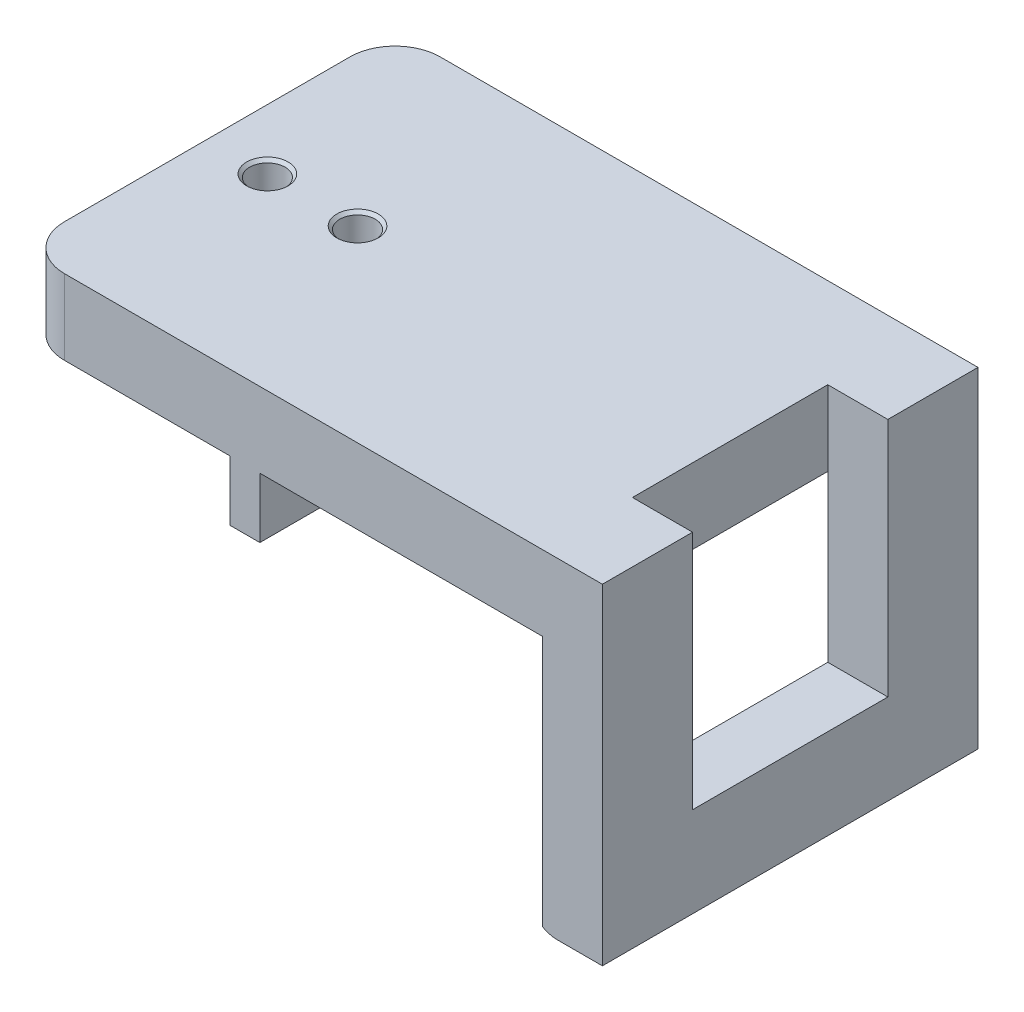
from build123d import *

# Parameters (mm, degrees)
SKETCH1_W             = 44.196
SKETCH1_H             = 31.75
BOSS_EXTRUDE1_DEPTH   = 6.35
SKETCH3_W             = 2.54
SKETCH3_H             = 31.75
BOSS_EXTRUDE3_DEPTH   = 5.08
F_3_0MM_DOWEL_HOLE1_D = 3
CHAMFER1_SIZE         = 0.254
FILLET2_R             = 3.81
BOSS_EXTRUDE4_DEPTH   = 5.08
SKETCH7_W             = 16.51
SKETCH7_H             = 2.54
BOSS_EXTRUDE5_DEPTH   = 1.27
FILLET3_R             = 2.54


with BuildPart() as part:
    # Sketch1 → Boss-Extrude1 (new body)
    with BuildSketch(Plane(origin=(0, 0, 0), x_dir=(1, 0, 0), z_dir=(0, 1, 0))):
        with Locations((22.098, 15.875)):
            Rectangle(SKETCH1_W, SKETCH1_H)
    extrude(amount=BOSS_EXTRUDE1_DEPTH)

    # Sketch3 → Boss-Extrude3 (add)
    with BuildSketch(Plane.XZ):
        with Locations((19.05, -15.875)):
            Rectangle(SKETCH3_W, SKETCH3_H)
    extrude(amount=BOSS_EXTRUDE3_DEPTH)

    # Ø3.0mm Dowel Hole1 (through all)
    with Locations(Plane(origin=(0, 6.35, 0), x_dir=(1, 0, 0), z_dir=(0, 1, 0))):
        with Locations((5.08, 15.875), (12.7, 15.875)):
            Hole(F_3_0MM_DOWEL_HOLE1_D / 2)

    # Chamfer1
    chamfer1_edges = [part.edges().sort_by_distance(p)[0] for p in [
        (14.2, 0, -15.875),
        (14.2, 6.35, -15.875),
        (6.58, 0, -15.875),
        (6.58, 6.35, -15.875),
    ]]
    chamfer(chamfer1_edges, length=CHAMFER1_SIZE)

    # Fillet2
    fillet2_edges = [part.edges().sort_by_distance(p)[0] for p in [
        (0, 3.175, 0),
        (0, 3.175, -31.75),
    ]]
    fillet(fillet2_edges, radius=FILLET2_R)

    # Sketch6 → Boss-Extrude4 (add)
    with BuildSketch(Plane(origin=(44.196, 0, 0), x_dir=(0, 0, -1), z_dir=(1, 0, 0))):
        Polygon((0, 6.35), (0, -21.59), (31.75, -21.59), (31.75, 6.35), (24.13, 6.35), (24.13, -13.97), (7.62, -13.97), (7.62, 6.35), align=None)
    extrude(amount=BOSS_EXTRUDE4_DEPTH)

    # Sketch7 → Boss-Extrude5 (add)
    with BuildSketch(Plane.ZY.offset(-44.196)):
        with Locations((-15.875, -20.32)):
            Rectangle(SKETCH7_W, SKETCH7_H)
    extrude(amount=BOSS_EXTRUDE5_DEPTH)

    # Fillet3
    fillet3_edges = [part.edges().sort_by_distance(p)[0] for p in [
        (42.926, -21.59, -15.875),
    ]]
    fillet(fillet3_edges, radius=FILLET3_R - 0.0001)  # a hair under: the kernel refuses the full size


solid = part.part
